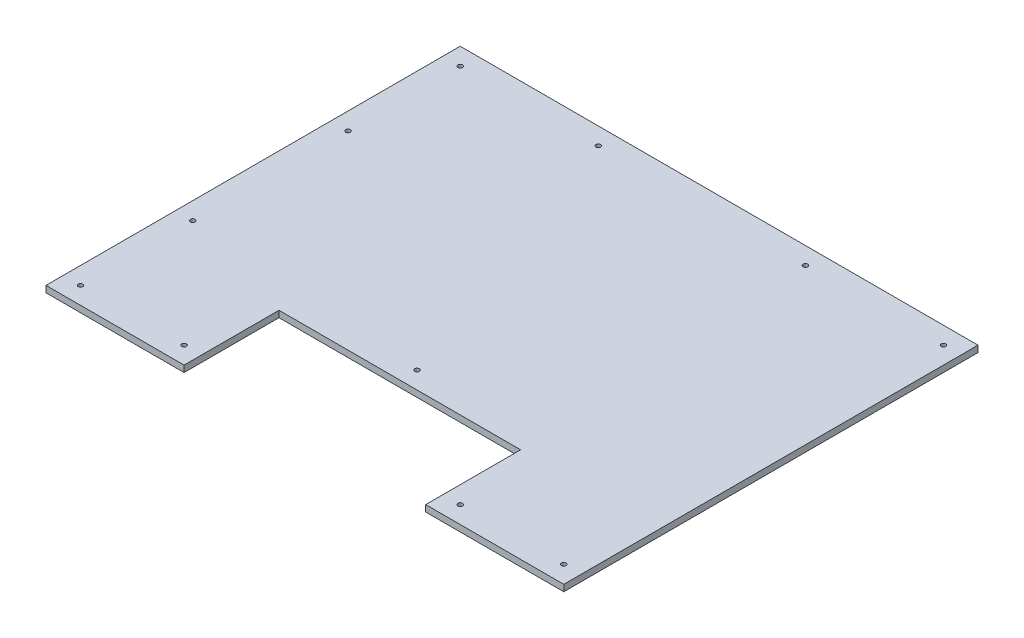
from build123d import *

# Parameters (mm, degrees)
BOSS_EXTRUDE1_DEPTH  = 4.7625
M3_CLEARANCE_HOLE1_D = 3.4


with BuildPart() as part:
    # Sketch1 → Boss-Extrude1 (new body)
    with BuildSketch(Plane(origin=(0, 0, 0), x_dir=(1, 0, 0), z_dir=(0, 1, 0))):
        Polygon((-190.5, -152.4), (-88.9, -152.4), (-88.9, -82.55), (88.9, -82.55), (88.9, -152.4), (190.5, -152.4), (190.5, 152.4), (-190.5, 152.4), align=None)
    extrude(amount=BOSS_EXTRUDE1_DEPTH)

    # M3 Clearance Hole1 (through all)
    with Locations(Plane(origin=(-76.2, 4.7625, -139.7), x_dir=(0, 0, 1), z_dir=(0, 1, 0))):
        with Locations((0, 0), (0, 152.4), (209.55, 76.2), (279.4, -25.4), (279.4, -101.6), (0, -101.6), (0, 254), (279.4, 254), (279.4, 177.8), (82.55, -101.6), (196.85, -101.6)):
            Hole(M3_CLEARANCE_HOLE1_D / 2)


solid = part.part
